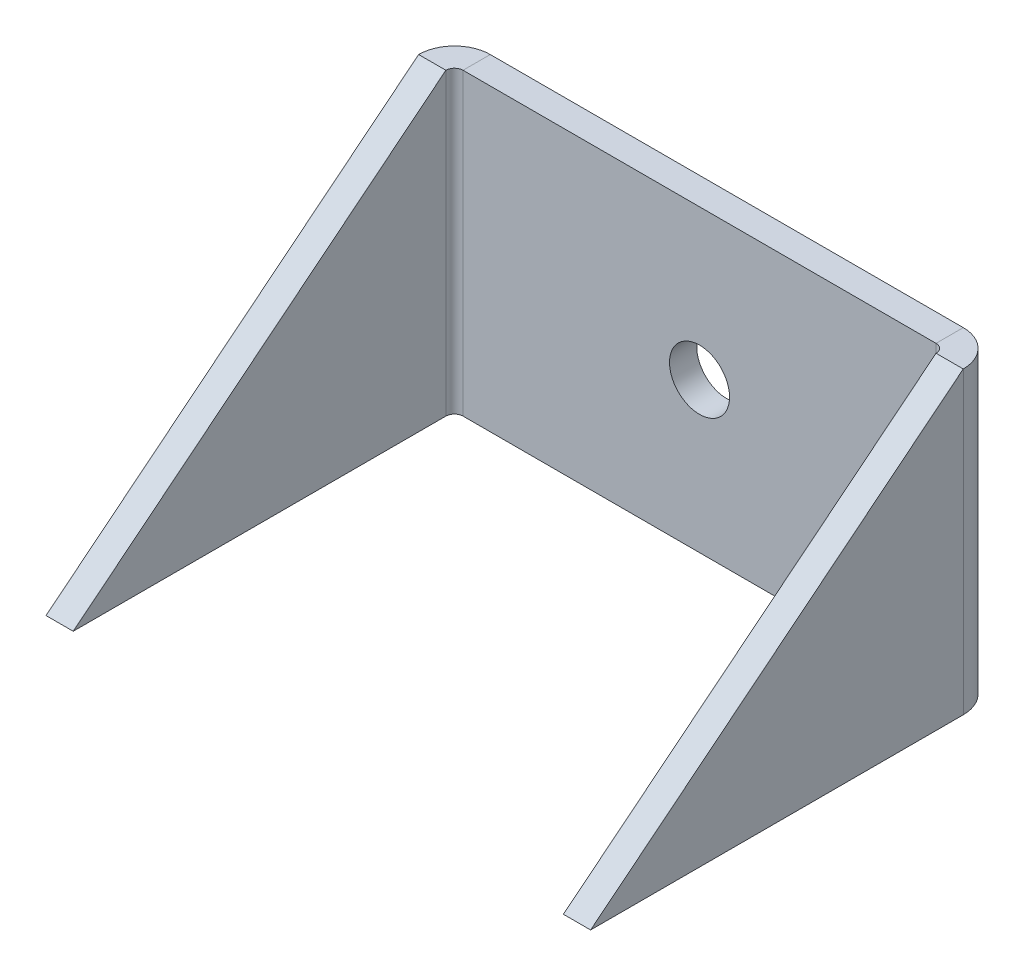
from build123d import *

# Parameters (mm, degrees)
SKETCH2_W                    = 57.15
SKETCH2_H                    = 34.925
BASE_FLANGE1_DEPTH           = 3.175
EDGE_FLANGE1_STRIP_W         = 14.7
EDGE_FLANGE1_STRIP_H         = 3.175
EDGE_FLANGE1_STRIP_CUT_DEPTH = 34.925
EDGE_FLANGE1_DEPTH           = 34.925
CUT_EXTRUDE1_DEPTH           = 3.175
M6_CLEARANCE_HOLE1_D         = 7


# Sheet-metal steps are written as plain solids
with BuildPart() as part:
    # Sketch2 → Base-Flange1 (new body)
    with BuildSketch(Plane.XY):
        Rectangle(SKETCH2_W, SKETCH2_H)
    extrude(amount=BASE_FLANGE1_DEPTH)

    # Edge-Flange1 strip (across the edge) → Edge-Flange1 strip cut (cut)
    with BuildSketch(Plane(origin=(28.575, -17.4625, 3.175), x_dir=(-1, 0, 0), z_dir=(0, 1, 0))):
        with Locations((-6.35, -1.5875)):
            Rectangle(EDGE_FLANGE1_STRIP_W, EDGE_FLANGE1_STRIP_H)
    edge_flange1_strip_cut = extrude(amount=EDGE_FLANGE1_STRIP_CUT_DEPTH, mode=Mode.SUBTRACT)

    # Edge-Flange1 section (across the edge) → Edge-Flange1 (add)
    with BuildSketch(Plane(origin=(28.575, -17.4625, 3.175), x_dir=(-1, 0, 0), z_dir=(0, 1, 0))):
        with BuildLine():
            Line((-3.175, 1), (-3.175, 44.45))
            Line((-3.175, 44.45), (0, 44.45))
            Line((0, 44.45), (0, 1))
            ThreePointArc((0, 1), (0.292893219, 0.292893219), (1, 0))
            Line((1, 0), (1, -3.175))
            ThreePointArc((1, -3.175), (-1.952170811, -1.952170811), (-3.175, 1))
        make_face()
    edge_flange1 = extrude(amount=EDGE_FLANGE1_DEPTH)

    # Sketch10 → Cut-Extrude1 (cut)
    with BuildSketch(Plane(origin=(31.75, 0, 0), x_dir=(0, 0, -1), z_dir=(1, 0, 0))):
        Polygon((-4.175, 17.4625), (-47.625, -17.4625), (-47.625, 17.4625), align=None)
    cut_extrude1 = extrude(amount=-CUT_EXTRUDE1_DEPTH, mode=Mode.SUBTRACT)

    # Mirror1: Edge-Flange1 strip cut, Edge-Flange1, Cut-Extrude1 across plane
    add(edge_flange1_strip_cut.mirror(Plane(origin=(0, 0, 0), x_dir=(0, 0, 1), z_dir=(1, 0, 0))), mode=Mode.SUBTRACT)
    add(edge_flange1.mirror(Plane(origin=(0, 0, 0), x_dir=(0, 0, 1), z_dir=(1, 0, 0))))
    add(cut_extrude1.mirror(Plane(origin=(0, 0, 0), x_dir=(0, 0, 1), z_dir=(1, 0, 0))), mode=Mode.SUBTRACT)

    # M6 Clearance Hole1 (through all)
    with Locations(Plane.XY.offset(3.175)):
        with Locations((0, 0)):
            Hole(M6_CLEARANCE_HOLE1_D / 2)


solid = part.part
